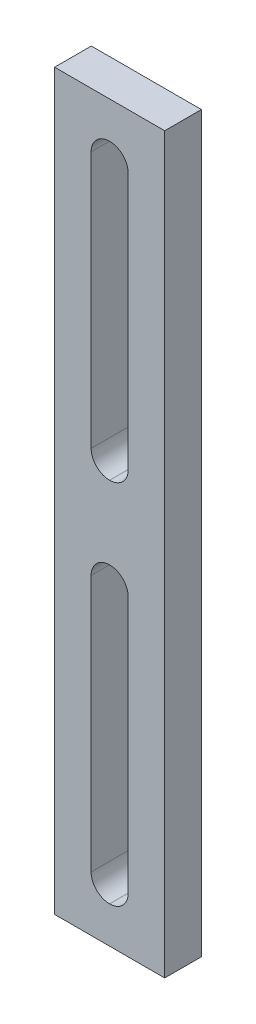
from build123d import *

# Parameters (mm, degrees)
SKETCH_1_W          = 30
SKETCH_1_H          = 200
EXTRUDE_1_DEPTH     = 10
CUT_EXTRUDE_1_DEPTH = 203.484567313


with BuildPart() as part:
    # Эскиз1 → Бобышка-Вытянуть1 (new body)
    with BuildSketch(Plane.XY):
        with Locations((15, 100)):
            Rectangle(SKETCH_1_W, SKETCH_1_H)
    extrude(amount=EXTRUDE_1_DEPTH)

    # Эскиз2 → Вырез-Вытянуть1 (cut, through all)
    with BuildSketch(Plane.XY.offset(10)):
        with BuildLine():
            Line((14.95, 190), (15.05, 190))
            ThreePointArc((15.05, 190), (18.585533906, 188.535533906), (20.05, 185))
            Line((20.05, 185), (20.05, 115))
            ThreePointArc((20.05, 115), (18.585533906, 111.464466094), (15.05, 110))
            Line((15.05, 110), (14.95, 110))
            ThreePointArc((14.95, 110), (11.414466094, 111.464466094), (9.95, 115))
            Line((9.95, 115), (9.95, 185))
            ThreePointArc((9.95, 185), (11.414466094, 188.535533906), (14.95, 190))
        make_face()
        with BuildLine():
            Line((14.95, 90), (15.05, 90))
            ThreePointArc((15.05, 90), (18.585533906, 88.535533906), (20.05, 85))
            Line((20.05, 85), (20.05, 15))
            ThreePointArc((20.05, 15), (18.585533906, 11.464466094), (15.05, 10))
            Line((15.05, 10), (14.95, 10))
            ThreePointArc((14.95, 10), (11.414466094, 11.464466094), (9.95, 15))
            Line((9.95, 15), (9.95, 85))
            ThreePointArc((9.95, 85), (11.414466094, 88.535533906), (14.95, 90))
        make_face()
    extrude(amount=-CUT_EXTRUDE_1_DEPTH, mode=Mode.SUBTRACT)


solid = part.part
